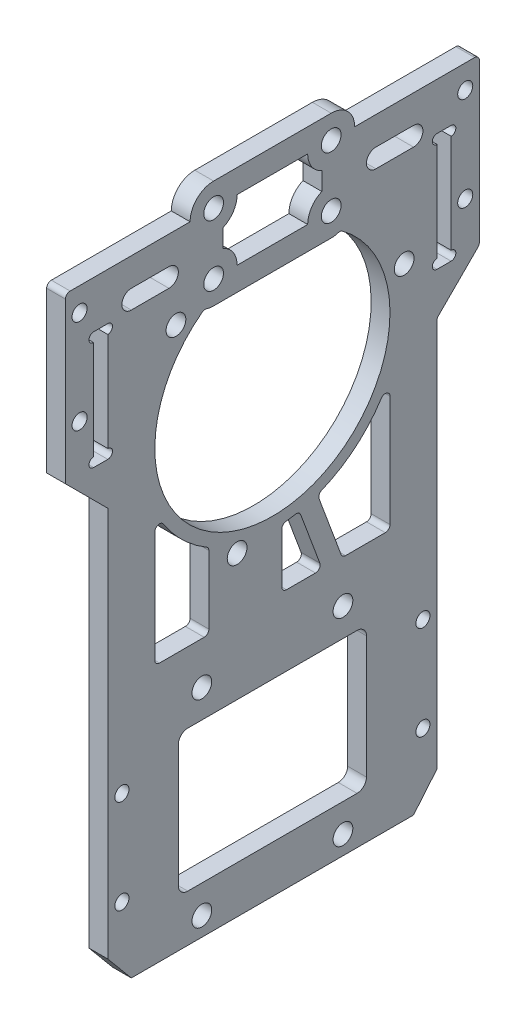
from build123d import *

# Parameters (mm, degrees)
SKETCH_1_W           = 60
SKETCH_1_H           = 50
SKETCH_1_R           = 2.1
EXTRUDE_1_DEPTH      = 4
EXTRUDE_2_DEPTH      = 4
EXTRUDE_4_DEPTH      = 4
SKETCH_10_W          = 9
SKETCH_10_H          = 10
SKETCH_10_W_2        = 3
EXTRUDE_5_DEPTH      = 4
CHAMFER_1_SIZE       = 10
SKETCH_11_R          = 25
SKETCH_11_R_2        = 2.1
CUT_EXTRUDE_7_DEPTH  = 10
CUT_EXTRUDE_8_DEPTH  = 10
EXTRUDE_6_DEPTH      = 4
SKETCH_16_R          = 1.6
CUT_EXTRUDE_9_DEPTH  = 4
CUT_EXTRUDE_11_DEPTH = 10
SKETCH_21_R          = 2.1
EXTRUDE_7_DEPTH      = 4
SKETCH_21_2_R        = 2.1
CUT_EXTRUDE_12_DEPTH = 10
CUT_EXTRUDE_13_DEPTH = 157.639713994
CUT_EXTRUDE_14_DEPTH = 157.639713994
SKETCH_24_R          = 1.5
CUT_EXTRUDE_15_DEPTH = 4
FILLET_1_R           = 1


with BuildPart() as part:
    # 草图1 → 凸台-拉伸1 (new body)
    with BuildSketch(Plane(origin=(0, 0, 0), x_dir=(0, 0, -1), z_dir=(1, 0, 0))):
        with Locations((30, 25)):
            Rectangle(SKETCH_1_W, SKETCH_1_H)
        with Locations((15, 4)):
            Circle(SKETCH_1_R, mode=Mode.SUBTRACT)
        with Locations((15, 46)):
            Circle(SKETCH_1_R, mode=Mode.SUBTRACT)
        with Locations(Location((45, 4, 0), (0, 0, 180))):
            Circle(SKETCH_1_R, mode=Mode.SUBTRACT)
        with Locations(Location((45, 46, 0), (0, 0, 180))):
            Circle(SKETCH_1_R, mode=Mode.SUBTRACT)
    extrude(amount=EXTRUDE_1_DEPTH)

    # 草图3 → 凸台-拉伸2 (add)
    with BuildSketch(Plane(origin=(4, 0, 0), x_dir=(0, 0, -1), z_dir=(1, 0, 0))):
        Polygon((0, 50), (-10, 38), (-10, 12), (0, 0), align=None)
        Polygon((70, 12), (60, 0), (60, 50), (70, 38), align=None)
    extrude(amount=-EXTRUDE_2_DEPTH)

    # 草图9 → 凸台-拉伸4 (add)
    with BuildSketch(Plane(origin=(4, 0, 0), x_dir=(0, 0, -1), z_dir=(1, 0, 0))):
        Polygon((60, 50), (65, 50), (65, 133), (60, 133), (0, 133), (-5, 133), (-5, 50), (0, 50), align=None)
        Polygon((-5, 50), (-5, 44), (0, 50), align=None)
        Polygon((65, 44), (60, 50), (65, 50), align=None)
    extrude(amount=-EXTRUDE_4_DEPTH)

    # 草图10 → 凸台-拉伸5 (add)
    with BuildSketch(Plane(origin=(4, 0, 0), x_dir=(0, 0, -1), z_dir=(1, 0, 0))):
        with Locations((-9.5, 128)):
            Rectangle(SKETCH_10_W, SKETCH_10_H)
        Polygon((-8, 123), (-14, 123), (-14, 88), (-8, 88), (-8, 98), align=None)
        with Locations((-6.5, 93)):
            Rectangle(SKETCH_10_W_2, SKETCH_10_H)
        with Locations((66.5, 93)):
            Rectangle(SKETCH_10_W_2, SKETCH_10_H)
        Polygon((68, 98), (68, 88), (74, 88), (74, 123), (68, 123), align=None)
        Polygon((65, 123), (68, 123), (74, 123), (74, 133), (65, 133), align=None)
    extrude(amount=-EXTRUDE_5_DEPTH)

    # 倒角1
    # the kernel refuses this chamfer: 10 mm, written as the material it takes off along each edge
    with BuildSketch(Plane(origin=(29.71682988, 88, -74), x_dir=(0, 0.9996219169112968, -0.027495876610586317), z_dir=(-1, 0, 0))) as chamfer_1_piece_1_section:
        Polygon((CHAMFER_1_SIZE * 0.999621916911, -CHAMFER_1_SIZE * 0.0274958766106), (-CHAMFER_1_SIZE * 0.0274958766106, -CHAMFER_1_SIZE * 0.999621916911), (0, 0), align=None)
    chamfer_1_piece_1 = extrude(amount=55.433659759, mode=Mode.PRIVATE)
    chamfer_1_piece_1 = split(chamfer_1_piece_1, bisect_by=Plane(origin=(2, 91.359007471, -65), z_dir=(0, 0, -1)), keep=Keep.TOP, mode=Mode.PRIVATE)
    add(chamfer_1_piece_1, mode=Mode.SUBTRACT)
    with BuildSketch(Plane(origin=(29.71682988, 88, 14), x_dir=(0, -0.027495876610586317, -0.9996219169112968), z_dir=(-1, 0, 0))) as chamfer_1_piece_2_section:
        Polygon((CHAMFER_1_SIZE * 0.999621916911, -CHAMFER_1_SIZE * 0.0274958766106), (-CHAMFER_1_SIZE * 0.0274958766106, -CHAMFER_1_SIZE * 0.999621916911), (0, 0), align=None)
    chamfer_1_piece_2 = extrude(amount=55.433659759, mode=Mode.PRIVATE)
    chamfer_1_piece_2 = split(chamfer_1_piece_2, bisect_by=Plane(origin=(2, 91.359007471, 5), z_dir=(0, 0, 1)), keep=Keep.TOP, mode=Mode.PRIVATE)
    add(chamfer_1_piece_2, mode=Mode.SUBTRACT)

    # 草图11 → 切除-拉伸7 (cut)
    with BuildSketch(Plane.ZY):
        with Locations((-30, 95)):
            Circle(SKETCH_11_R)
        with Locations((-9.493903346, 115.506096654)):
            Circle(SKETCH_11_R_2)
        with Locations((-22.494247692, 66.988151038)):
            Circle(SKETCH_11_R_2)
        with Locations((-58.011848962, 102.505752308)):
            Circle(SKETCH_11_R_2)
    extrude(amount=-CUT_EXTRUDE_7_DEPTH, mode=Mode.SUBTRACT)

    # 草图12 → 切除-拉伸8 (cut)
    with BuildSketch(Plane.ZY):
        with BuildLine():
            ThreePointArc((-32, 67.572823696), (-45.68490072, 72.411642614), (-55, 83.543560763))
            Line((-55, 83.543560763), (-55, 55))
            Line((-55, 55), (-32, 55))
            Line((-32, 55), (-32, 67.572823696))
        make_face()
        with BuildLine():
            ThreePointArc((-5, 83.543560763), (-9.75828346, 76.38487412), (-16.494247692, 71.044945114))
            Line((-16.494247692, 71.044945114), (-16.494247692, 55))
            Line((-16.494247692, 55), (-5, 55))
            Line((-5, 55), (-5, 83.543560763))
        make_face()
    extrude(amount=-CUT_EXTRUDE_8_DEPTH, mode=Mode.SUBTRACT)

    # 草图14 → 凸台-拉伸6 (add)
    with BuildSketch(Plane.ZY):
        with BuildLine():
            Line((-44.857355631, 55), (-39.575250068, 69.220849779))
            ThreePointArc((-39.575250068, 69.220849779), (-37.669905745, 68.591241115), (-35.723722086, 68.102249063))
            Line((-35.723722086, 68.102249063), (-40.590341434, 55))
            Line((-40.590341434, 55), (-44.857355631, 55))
        make_face()
    extrude(amount=-EXTRUDE_6_DEPTH)

    # 草图16 → 切除-拉伸9 (cut)
    with BuildSketch(Plane(origin=(4, 0, 0), x_dir=(0, 0, -1), z_dir=(1, 0, 0))):
        with Locations((-11, 128)):
            Circle(SKETCH_16_R)
        with Locations((-11, 108)):
            Circle(SKETCH_16_R)
        with Locations((71, 108)):
            Circle(SKETCH_16_R)
        with Locations((71, 128)):
            Circle(SKETCH_16_R)
    extrude(amount=-CUT_EXTRUDE_9_DEPTH, mode=Mode.SUBTRACT)

    # 草图20 → 切除-拉伸11 (cut)
    with BuildSketch(Plane.ZY):
        with BuildLine():
            ThreePointArc((8, 121), (9, 122), (8, 123))
            Line((8, 123), (8, 121))
        make_face()
        with BuildLine():
            Line((8, 100), (8, 98))
            ThreePointArc((8, 98), (9, 99), (8, 100))
        make_face()
        with BuildLine():
            Line((5, 121), (5, 123))
            ThreePointArc((5, 123), (4, 122), (5, 121))
        make_face()
        with BuildLine():
            ThreePointArc((5, 100), (4, 99), (5, 98))
            Line((5, 98), (5, 100))
        make_face()
        with BuildLine():
            Line((-65, 100), (-65, 98))
            ThreePointArc((-65, 98), (-64, 99), (-65, 100))
        make_face()
        with BuildLine():
            ThreePointArc((-65, 121), (-64, 122), (-65, 123))
            Line((-65, 123), (-65, 121))
        make_face()
        with BuildLine():
            ThreePointArc((-68, 100), (-69, 99), (-68, 98))
            Line((-68, 98), (-68, 100))
        make_face()
        with BuildLine():
            Line((-68, 121), (-68, 123))
            ThreePointArc((-68, 123), (-69, 122), (-68, 121))
        make_face()
    extrude(amount=-CUT_EXTRUDE_11_DEPTH, mode=Mode.SUBTRACT)

    # 草图21 → 凸台-拉伸7 (add)
    # profile 1 of 2: a face of its own
    with BuildSketch(Plane(origin=(4, 0, 0), x_dir=(0, 0, -1), z_dir=(1, 0, 0))):
        with BuildLine():
            Line((17.5, 138), (42.5, 138))
            ThreePointArc((42.5, 138), (46.035533906, 129.464466094), (37.5, 133))
            Line((37.5, 133), (22.5, 133))
            ThreePointArc((22.5, 133), (13.964466094, 129.464466094), (17.5, 138))
        make_face()
        with Locations((17.5, 133)):
            Circle(SKETCH_21_R, mode=Mode.SUBTRACT)
        with Locations((42.5, 133)):
            Circle(SKETCH_21_R, mode=Mode.SUBTRACT)
    # profile 2 of 2: a face of its own
    with BuildSketch(Plane(origin=(4, 0, 0), x_dir=(0, 0, -1), z_dir=(1, 0, 0))):
        with BuildLine():
            Line((42.5, 115), (17.5, 115))
            ThreePointArc((17.5, 115), (13.964466094, 123.535533906), (22.5, 120))
            Line((22.5, 120), (37.5, 120))
            ThreePointArc((37.5, 120), (46.035533906, 123.535533906), (42.5, 115))
        make_face()
        with Locations((17.5, 120)):
            Circle(SKETCH_21_R, mode=Mode.SUBTRACT)
        with Locations((42.5, 120)):
            Circle(SKETCH_21_R, mode=Mode.SUBTRACT)
    extrude(amount=-EXTRUDE_7_DEPTH)

    # 草图21<2> → 切除-拉伸12 (cut)
    with BuildSketch(Plane(origin=(4, 0, 0), x_dir=(0, 0, -1), z_dir=(1, 0, 0))):
        with Locations((17.5, 133)):
            Circle(SKETCH_21_2_R)
        with Locations((17.5, 120)):
            Circle(SKETCH_21_2_R)
        with Locations((42.5, 120)):
            Circle(SKETCH_21_2_R)
        with Locations((42.5, 133)):
            Circle(SKETCH_21_2_R)
    extrude(amount=-CUT_EXTRUDE_12_DEPTH, mode=Mode.SUBTRACT)

    # 草图22 → 切除-拉伸13 (cut, through all)
    with BuildSketch(Plane(origin=(4, 0, 0), x_dir=(0, 0, -1), z_dir=(1, 0, 0))):
        with BuildLine():
            Line((22.5, 133), (37.5, 133))
            ThreePointArc((37.5, 133), (38.316699867, 130.261387212), (40.5, 128.417424305))
            Line((40.5, 128.417424305), (40.5, 124.582575695))
            ThreePointArc((40.5, 124.582575695), (38.316699867, 122.738612788), (37.5, 120))
            Line((37.5, 120), (22.5, 120))
            ThreePointArc((22.5, 120), (21.683300133, 122.738612788), (19.5, 124.582575695))
            Line((19.5, 124.582575695), (19.5, 128.417424305))
            ThreePointArc((19.5, 128.417424305), (21.683300133, 130.261387212), (22.5, 133))
        make_face()
    extrude(amount=-CUT_EXTRUDE_13_DEPTH, mode=Mode.SUBTRACT)

    # 草图23 → 切除-拉伸14 (cut, through all)
    with BuildSketch(Plane(origin=(4, 0, 0), x_dir=(0, 0, -1), z_dir=(1, 0, 0))):
        with BuildLine():
            Line((0, 127), (8, 127))
            ThreePointArc((8, 127), (10, 125), (8, 123))
            Line((8, 123), (0, 123))
            ThreePointArc((0, 123), (-2, 125), (0, 127))
        make_face()
        with BuildLine():
            Line((60, 127), (52, 127))
            ThreePointArc((52, 127), (50, 125), (52, 123))
            Line((52, 123), (60, 123))
            ThreePointArc((60, 123), (62, 125), (60, 127))
        make_face()
    extrude(amount=-CUT_EXTRUDE_14_DEPTH, mode=Mode.SUBTRACT)

    # 草图24 → 切除-拉伸15 (cut)
    with BuildSketch(Plane.ZY):
        with Locations((-62, 35)):
            Circle(SKETCH_24_R)
        with Locations((-62, 15)):
            Circle(SKETCH_24_R)
        with Locations((2, 15)):
            Circle(SKETCH_24_R)
        with Locations((2, 35)):
            Circle(SKETCH_24_R)
        Polygon((-65, 44), (-65, 6), (-70, 12), (-70, 38), align=None)
        Polygon((5, 44), (5, 6), (10, 12), (10, 38), align=None)
        with BuildLine():
            Line((-48, 40), (-12, 40))
            ThreePointArc((-12, 40), (-10.585786438, 39.414213562), (-10, 38))
            Line((-10, 38), (-10, 12))
            ThreePointArc((-10, 12), (-10.585786438, 10.585786438), (-12, 10))
            Line((-12, 10), (-48, 10))
            ThreePointArc((-48, 10), (-49.414213562, 10.585786438), (-50, 12))
            Line((-50, 12), (-50, 38))
            ThreePointArc((-50, 38), (-49.414213562, 39.414213562), (-48, 40))
        make_face()
    extrude(amount=-CUT_EXTRUDE_15_DEPTH, mode=Mode.SUBTRACT)

    # 圆角1
    fillet_1_edges = [part.edges().sort_by_distance(p)[0] for p in [
        (2, 133, -74),
        (2, 98, -74),
        (2, 89, -65),
        (2, 83.543560763, -55),
        (2, 67.572823696, -32),
        (2, 55, -32),
        (2, 55, -55),
        (2, 71.044945114, -16.494247692),
        (2, 83.543560763, -5),
        (2, 55, -5),
        (2, 55, -16.494247692),
        (2, 69.220849779, -39.575250068),
        (2, 68.102249063, -35.723722086),
        (2, 55, -40.590341434),
        (2, 55, -44.857355631),
        (2, 115.397795547, -15.545591094),
        (2, 115.397795547, -44.454408906),
        (2, 133, 14),
    ]]
    fillet(fillet_1_edges, radius=FILLET_1_R)


solid = part.part
